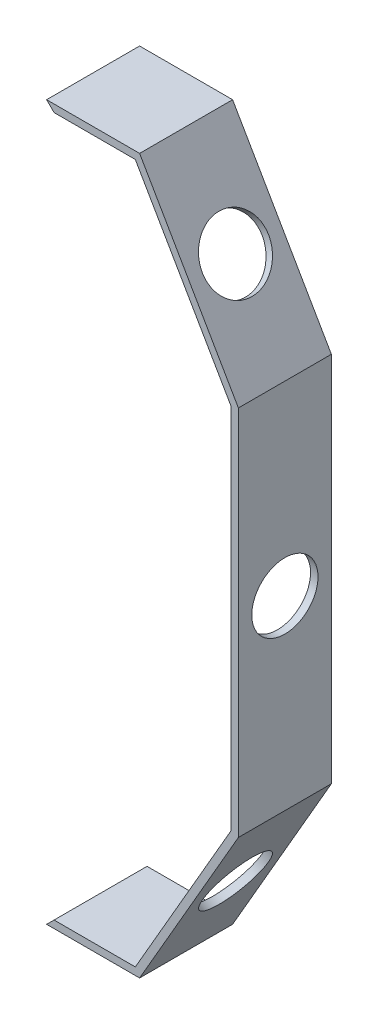
from build123d import *

# Parameters (mm, degrees)
SALIENTE_EXTRUIR2_DEPTH = 25
CROQUIS3_R              = 8.9
CORTAR_EXTRUIR1_DEPTH   = 25
CROQUIS4_R              = 8.9
CORTAR_EXTRUIR2_DEPTH   = 25
CROQUIS5_R              = 8.9
CORTAR_EXTRUIR3_DEPTH   = 25


with BuildPart() as part:
    # Croquis1 → Saliente-Extruir2 (new body)
    with BuildSketch(Plane.XY):
        Polygon((12.5, 96), (39.058112383, 50), (39.058112383, -50), (12.5, -96), (-12.5, -96), (-10.5, -94), (11.345299462, -94), (37.058112383, -49.464101615), (37.058112383, 49.464101615), (11.345299462, 94), (-10.5, 94), (-12.5, 96), align=None)
    extrude(amount=SALIENTE_EXTRUIR2_DEPTH)

    # Croquis3 → Cortar-Extruir1 (cut)
    with BuildSketch(Plane(origin=(39.058112383, 0, 0), x_dir=(0, 0, -1), z_dir=(1, 0, 0))):
        with Locations((-12.5, 0)):
            Circle(CROQUIS3_R)
    extrude(amount=-CORTAR_EXTRUIR1_DEPTH, mode=Mode.SUBTRACT)

    # Croquis4 → Cortar-Extruir2 (cut)
    with BuildSketch(Plane(origin=(50.944219382, 29.412658774, 0), x_dir=(0, 0, -1), z_dir=(0.8660254037844347, 0.500000000000007, 0))):
        with Locations((-12.5, 50.330326381)):
            Circle(CROQUIS4_R)
    extrude(amount=-CORTAR_EXTRUIR2_DEPTH, mode=Mode.SUBTRACT)

    # Croquis5 → Cortar-Extruir3 (cut)
    with BuildSketch(Plane(origin=(50.944219382, -29.412658774, 0), x_dir=(0, 0, -1), z_dir=(0.8660254037844347, -0.500000000000007, 0))):
        with Locations((-12.5, -50.330326381)):
            Circle(CROQUIS5_R)
    extrude(amount=-CORTAR_EXTRUIR3_DEPTH, mode=Mode.SUBTRACT)


solid = part.part
